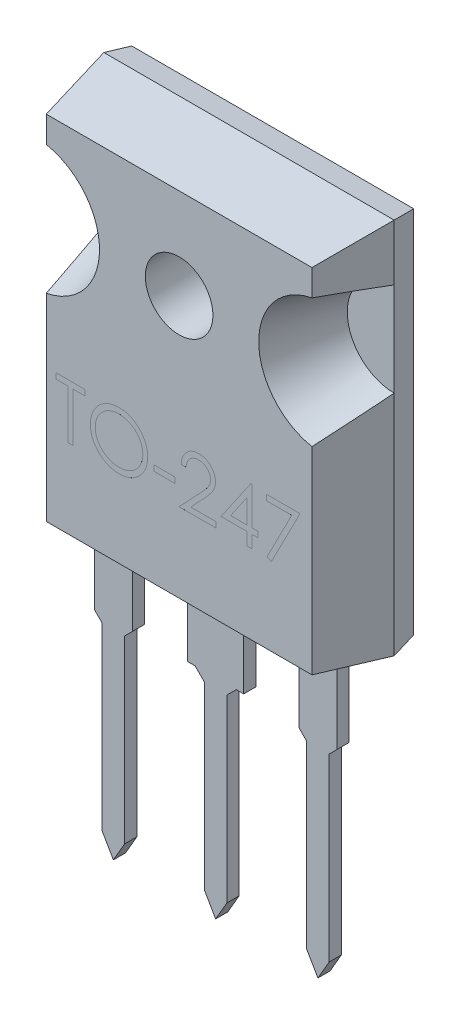
from build123d import *

# Parameters (mm, degrees)
SKETCH1_W                     = 15.5
SKETCH1_H                     = 20.15
BOSS_EXTRUDE1_DEPTH           = 1.27
BOSS_EXTRUDE1_TAPER           = 10
BOSS_EXTRUDE1_OTHER_WAY_DEPTH = 3.73
BOSS_EXTRUDE1_OTHER_WAY_TAPER = 10
SKETCH2_R                     = 2.5
CUT_EXTRUDE1_DEPTH            = 3.73
CUT_EXTRUDE1_DRAFT            = -15
CUT_EXTRUDE1_PROFILE_2_DEPTH  = 3.73
CUT_EXTRUDE1_PROFILE_2_DRAFT  = -15
CUT_EXTRUDE2_DEPTH            = 14.246925249
CUT_EXTRUDE2_DEPTH_BACK       = 14.246925249
SKETCH4_R                     = 1.805
SKETCH5_W                     = 2.02
SKETCH5_H                     = 0.65
SKETCH5_W_2                   = 3
BOSS_EXTRUDE2_DEPTH           = 14.07
SKETCH6_W                     = 7.97
SKETCH6_H                     = 2.154431013
BOSS_EXTRUDE3_DEPTH           = 0.65
SKETCH7_R                     = 1.805
BOSS_EXTRUDE4_DEPTH           = 0.0001
BOSS_EXTRUDE5_DEPTH           = 0.65
CUT_EXTRUDE3_DEPTH            = 1
CHAMFER1_SIZE                 = 0.5
SKETCH10_W                    = 1.119391026
SKETCH10_H                    = 0.298504273
CUT_EXTRUDE4_DEPTH            = 0.0001


with BuildPart() as part:
    # Sketch1 → Boss-Extrude1 (new body)
    with BuildSketch(Plane.XY):
        Rectangle(SKETCH1_W, SKETCH1_H)
    extrude(amount=-BOSS_EXTRUDE1_DEPTH, taper=BOSS_EXTRUDE1_TAPER)

    # Sketch1 → Boss-Extrude1 other way (add)
    with BuildSketch(Plane.XY):
        Rectangle(SKETCH1_W, SKETCH1_H)
    extrude(amount=BOSS_EXTRUDE1_OTHER_WAY_DEPTH, taper=BOSS_EXTRUDE1_OTHER_WAY_TAPER)


with BuildPart() as cut_extrude1_tool:
    # Sketch2 → Cut-Extrude1 (with draft: the straight prism first)
    with BuildSketch(Plane.XY):
        with Locations((-7.75, 4.575)):
            Circle(SKETCH2_R)
    extrude(amount=CUT_EXTRUDE1_DEPTH)
    # Cut-Extrude1: the draft: its side faces are tilted about the plane it starts from
    cut_extrude1_sides = [cut_extrude1_tool.faces().sort_by_distance(p)[0] for p in [
        (-10.25, 4.575, 1.865),
    ]]
    draft(cut_extrude1_sides, Plane.XY, CUT_EXTRUDE1_DRAFT)


with BuildPart() as part_1:
    add(part.part)

    # Cut-Extrude1: cut by cut_extrude1_tool
    add(cut_extrude1_tool.part, mode=Mode.SUBTRACT)


with BuildPart() as cut_extrude1_profile_2_tool:
    # Sketch2 → Cut-Extrude1 profile 2 (with draft: the straight prism first)
    with BuildSketch(Plane.XY):
        with Locations((7.75, 4.575)):
            Circle(SKETCH2_R)
    extrude(amount=CUT_EXTRUDE1_PROFILE_2_DEPTH)
    # Cut-Extrude1 profile 2: the draft: its side faces are tilted about the plane it starts from
    cut_extrude1_profile_2_sides = [cut_extrude1_profile_2_tool.faces().sort_by_distance(p)[0] for p in [
        (5.25, 4.575, 1.865),
    ]]
    draft(cut_extrude1_profile_2_sides, Plane.XY, CUT_EXTRUDE1_PROFILE_2_DRAFT)


with BuildPart() as part_2:
    add(part_1.part)

    # Cut-Extrude1 profile 2: cut by cut_extrude1_profile_2_tool
    add(cut_extrude1_profile_2_tool.part, mode=Mode.SUBTRACT)

    # Sketch4 → Cut-Extrude2 (cut, two sides: drawn at the far end of the back side and taken through both)
    with BuildSketch(Plane.XY.offset(-CUT_EXTRUDE2_DEPTH_BACK)):
        with Locations(Location((0, 4.565, 0), (0, 0, 180))):
            Circle(SKETCH4_R)
    extrude(amount=CUT_EXTRUDE2_DEPTH + CUT_EXTRUDE2_DEPTH_BACK, mode=Mode.SUBTRACT)

    # Sketch5 → Boss-Extrude2 (add)
    with BuildSketch(Plane(origin=(0, 0, 0), x_dir=(1, 0, 0), z_dir=(0, 1, 0))):
        with Locations((-5.46, -1.455)):
            Rectangle(SKETCH5_W, SKETCH5_H)
        with Locations((5.46, -1.455)):
            Rectangle(SKETCH5_W, SKETCH5_H)
        with Locations((0, -1.455)):
            Rectangle(SKETCH5_W_2, SKETCH5_H)
    extrude(amount=-BOSS_EXTRUDE2_DEPTH)

    # Sketch6 → Boss-Extrude3 (add)
    with BuildSketch(Plane.XY.offset(1.78)):
        with Locations((-2.485, -12.992784494)):
            Rectangle(SKETCH6_W, SKETCH6_H)
    extrude(amount=-BOSS_EXTRUDE3_DEPTH)

    # Sketch7 → Boss-Extrude4 (add)
    with BuildSketch(Plane(origin=(0, 0, -1.27), x_dir=(-1, 0, 0), z_dir=(0, 0, -1))):
        with BuildLine():
            Line((-5.9, 9.225), (5.9, 9.225))
            ThreePointArc((5.9, 9.225), (6.607106781, 8.932106781), (6.9, 8.225))
            Line((6.9, 8.225), (6.9, -3.855))
            Line((6.9, -3.855), (-6.9, -3.855))
            Line((-6.9, -3.855), (-6.9, 8.225))
            ThreePointArc((-6.9, 8.225), (-6.607106781, 8.932106781), (-5.9, 9.225))
        make_face()
        with Locations((0, 4.565)):
            Circle(SKETCH7_R, mode=Mode.SUBTRACT)
    extrude(amount=BOSS_EXTRUDE4_DEPTH)

    # Sketch8 → Boss-Extrude5 (add)
    with BuildSketch(Plane.XY.offset(1.78)):
        Polygon((-6.06, -14.07), (-6.06, -24.185769515), (-5.46, -25.225), (-4.86, -24.185769515), (-4.86, -14.07), align=None)
        Polygon((6.06, -14.07), (6.06, -24.185769515), (5.46, -25.225), (4.86, -24.185769515), (4.86, -14.07), align=None)
        Polygon((-0.6, -14.07), (-0.6, -24.185769515), (0, -25.225), (0.6, -24.185769515), (0.6, -14.07), align=None)
    extrude(amount=-BOSS_EXTRUDE5_DEPTH)

    # Sketch9 → Cut-Extrude3 (cut)
    with BuildSketch(Plane.XY.offset(1.78)):
        Polygon((-1.5, -11.915568987), (-1.5, -14.07), (-1.5, -14.32), (-4.45, -14.32), (-4.45, -14.07), (-4.45, -11.915568987), align=None)
    extrude(amount=-CUT_EXTRUDE3_DEPTH, mode=Mode.SUBTRACT)

    # Chamfer1
    # the kernel refuses this chamfer: 0.5 mm, written as the material it adds along each edge
    with BuildSketch(Plane(origin=(-4.86, -14.07, 1.78), x_dir=(0.9996219169112968, 0.027495876610585647, 0), z_dir=(0, 0, -1))) as chamfer1_piece_1_section:
        Polygon((CHAMFER1_SIZE * 0.999621916911, CHAMFER1_SIZE * 0.0274958766106), (-CHAMFER1_SIZE * 0.0274958766106, CHAMFER1_SIZE * 0.999621916911), (0, 0), align=None)
    chamfer1_piece_1 = extrude(amount=0.65, mode=Mode.PRIVATE)
    chamfer1_piece_1 = split(chamfer1_piece_1, bisect_by=Plane(origin=(-4.45, -14.241727984, 1.455), z_dir=(-1, 0, 0)), keep=Keep.TOP, mode=Mode.PRIVATE)
    add(chamfer1_piece_1)
    with BuildSketch(Plane(origin=(-6.06, -14.07, 1.78), x_dir=(-0.9996219169112968, 0.027495876610585647, 0), z_dir=(0, 0, -1))) as chamfer1_piece_2_section:
        Polygon((CHAMFER1_SIZE * 0.999621916911, -CHAMFER1_SIZE * 0.0274958766106), (-CHAMFER1_SIZE * 0.0274958766106, -CHAMFER1_SIZE * 0.999621916911), (0, 0), align=None)
    chamfer1_piece_2 = extrude(amount=0.65, mode=Mode.PRIVATE)
    chamfer1_piece_2 = split(chamfer1_piece_2, bisect_by=Plane(origin=(-6.47, -14.241727984, 1.455), z_dir=(1, 0, 0)), keep=Keep.TOP, mode=Mode.PRIVATE)
    add(chamfer1_piece_2)
    with BuildSketch(Plane(origin=(0.6, -14.07, 1.78), x_dir=(0.9996219169112968, 0.027495876610585647, 0), z_dir=(0, 0, -1))) as chamfer1_piece_3:
        Polygon((CHAMFER1_SIZE * 0.999621916911, CHAMFER1_SIZE * 0.0274958766106), (-CHAMFER1_SIZE * 0.0274958766106, CHAMFER1_SIZE * 0.999621916911), (0, 0), align=None)
    extrude(amount=0.65)
    with BuildSketch(Plane(origin=(-0.6, -14.07, 1.78), x_dir=(-0.9996219169112968, 0.027495876610585616, 0), z_dir=(0, 0, -1))) as chamfer1_piece_4:
        Polygon((CHAMFER1_SIZE * 0.999621916911, -CHAMFER1_SIZE * 0.0274958766106), (-CHAMFER1_SIZE * 0.0274958766106, -CHAMFER1_SIZE * 0.999621916911), (0, 0), align=None)
    extrude(amount=0.65)
    with BuildSketch(Plane(origin=(6.06, -14.07, 1.78), x_dir=(0.999621916911297, 0.0274958766105822, 0), z_dir=(0, 0, -1))) as chamfer1_piece_5_section:
        Polygon((CHAMFER1_SIZE * 0.999621916911, CHAMFER1_SIZE * 0.0274958766106), (-CHAMFER1_SIZE * 0.0274958766106, CHAMFER1_SIZE * 0.999621916911), (0, 0), align=None)
    chamfer1_piece_5 = extrude(amount=0.65, mode=Mode.PRIVATE)
    chamfer1_piece_5 = split(chamfer1_piece_5, bisect_by=Plane(origin=(6.47, -14.241727984, 1.455), z_dir=(-1, 0, 0)), keep=Keep.TOP, mode=Mode.PRIVATE)
    add(chamfer1_piece_5)
    with BuildSketch(Plane(origin=(4.86, -14.07, 1.78), x_dir=(-0.999621916911297, 0.0274958766105822, 0), z_dir=(0, 0, -1))) as chamfer1_piece_6_section:
        Polygon((CHAMFER1_SIZE * 0.999621916911, -CHAMFER1_SIZE * 0.0274958766106), (-CHAMFER1_SIZE * 0.0274958766106, -CHAMFER1_SIZE * 0.999621916911), (0, 0), align=None)
    chamfer1_piece_6 = extrude(amount=0.65, mode=Mode.PRIVATE)
    chamfer1_piece_6 = split(chamfer1_piece_6, bisect_by=Plane(origin=(4.45, -14.241727984, 1.455), z_dir=(1, 0, 0)), keep=Keep.TOP, mode=Mode.PRIVATE)
    add(chamfer1_piece_6)

    # Sketch10 → Cut-Extrude4 (cut)
    # profile 1 of 6: a face of its own
    with BuildSketch(Plane.XY.offset(3.73)):
        Polygon((-6.567094017, -2.579909172), (-6.567094017, -2.281404898), (-5.037259615, -2.281404898), (-5.037259615, -2.579909172), (-5.671581197, -2.579909172), (-5.671581197, -5.191821565), (-5.932772436, -5.191821565), (-5.932772436, -2.579909172), align=None)
    # profile 2 of 6: a face of its own
    with BuildSketch(Plane.XY.offset(3.73)):
        with BuildLine():
            add(Edge.make_bspline(
                [(-3.227577457, -2.20677883), (-3.173686431, -2.208143798), (-3.067840009, -2.210824709), (-2.912278324, -2.231346558), (-2.763767997, -2.266849808), (-2.621099257, -2.314134086), (-2.485978609, -2.377210619), (-2.357389006, -2.453451186), (-2.235636404, -2.543654527), (-2.122361838, -2.647123355), (-2.018703648, -2.759701143), (-1.927378194, -2.879841405), (-1.850840643, -3.006817731), (-1.787987462, -3.140248553), (-1.738677844, -3.279832109), (-1.704651711, -3.426312551), (-1.682916594, -3.578740793), (-1.68037557, -3.682706584), (-1.679086538, -3.735447199)],
                knots=[0, 0, 0, 0, 1.065120563, 2.091984664, 3.0946048, 4.079830382, 5.057816894, 6.036188127, 7.030412546, 8.04752943, 9.064399622, 10.05169764, 11.02544977, 11.989514704, 12.962713494, 13.945757189, 14.957906945, 16, 16, 16, 16], degree=3))
            add(Edge.make_bspline(
                [(-1.679086538, -3.735447199), (-1.680375381, -3.787799314), (-1.682915839, -3.890991397), (-1.704676424, -4.042452344), (-1.73880397, -4.188048596), (-1.787529556, -4.327537094), (-1.850083123, -4.461064985), (-1.92713031, -4.588280922), (-2.017886424, -4.709226612), (-2.121170335, -4.822577084), (-2.233762749, -4.926518433), (-2.354528632, -5.017089665), (-2.480752006, -5.095025737), (-2.614057162, -5.157211923), (-2.75267618, -5.206915122), (-2.897849696, -5.240802874), (-3.048897455, -5.262661802), (-3.151902093, -5.265171842), (-3.204256811, -5.266447633)],
                knots=[0, 0, 0, 0, 1.043624062, 2.057103931, 3.04512605, 4.022047818, 4.998200453, 5.980619268, 6.982898556, 8.009068085, 9.034988726, 10.034168286, 11.015286542, 11.987931943, 12.962482838, 13.94673481, 14.956375938, 16, 16, 16, 16], degree=3))
            add(Edge.make_bspline(
                [(-3.204256811, -5.266447633), (-3.256997152, -5.265159244), (-3.360962405, -5.262619487), (-3.513582189, -5.240848402), (-3.660165527, -5.206803758), (-3.800293235, -5.158150376), (-3.934043453, -5.095271048), (-4.061677766, -5.018598716), (-4.182683866, -4.927621468), (-4.296058521, -4.824371049), (-4.39979342, -4.711969466), (-4.49023202, -4.591532887), (-4.566921593, -4.465424153), (-4.629589793, -4.333293295), (-4.679203632, -4.195779065), (-4.713051627, -4.051964171), (-4.734951225, -3.902668522), (-4.737474844, -3.801017731), (-4.738755342, -3.749439587)],
                knots=[0, 0, 0, 0, 1.053102029, 2.075944431, 3.073151272, 4.055350789, 5.033113405, 6.020478099, 7.024410459, 8.052272461, 9.079885166, 10.07527673, 11.055994387, 12.023226415, 12.992069828, 13.970394897, 14.97016774, 16, 16, 16, 16], degree=3))
            add(Edge.make_bspline(
                [(-4.738755342, -3.749439587), (-4.738310767, -3.71482004), (-4.737427226, -3.646017688), (-4.726790324, -3.543848259), (-4.711355386, -3.44332192), (-4.689234629, -3.344724531), (-4.660303701, -3.24829745), (-4.626166985, -3.153375655), (-4.584473316, -3.060921094), (-4.537340658, -2.970495786), (-4.484735453, -2.883509331), (-4.426630439, -2.801286249), (-4.365066505, -2.723136575), (-4.297575278, -2.651085465), (-4.226381127, -2.583036883), (-4.150329131, -2.520036576), (-4.069883348, -2.461516453), (-3.984697631, -2.408779419), (-3.896871006, -2.361082567), (-3.80633478, -2.320152254), (-3.714318572, -2.285022643), (-3.620391403, -2.256549766), (-3.524802699, -2.234071341), (-3.427343834, -2.21876475), (-3.328092451, -2.208100719), (-3.26122661, -2.207221355), (-3.227577457, -2.20677883)],
                knots=[0, 0, 0, 0, 1.037015668, 2.060948919, 3.074880161, 4.083647147, 5.086022904, 6.090072063, 7.104153813, 8.122640571, 9.144368836, 10.147691507, 11.138137339, 12.123020368, 13.103399296, 14.087645067, 15.080126199, 16.082011238, 17.087798457, 18.072939717, 19.057185487, 20.037253025, 21.01195951, 21.997135196, 22.992090687, 24, 24, 24, 24], degree=3))
        make_face()
        with BuildLine():
            add(Edge.make_bspline(
                [(-3.214751102, -2.505283103), (-3.242370651, -2.505619789), (-3.297345705, -2.506289941), (-3.379073977, -2.515117414), (-3.459727389, -2.527698637), (-3.539322597, -2.5456447), (-3.617526565, -2.57009557), (-3.695068248, -2.598235896), (-3.77124055, -2.632513196), (-3.845792002, -2.671240618), (-3.918066025, -2.714106), (-3.986263492, -2.761480737), (-4.050560952, -2.812253833), (-4.110800978, -2.866543778), (-4.166806685, -2.924627048), (-4.219680392, -2.985623092), (-4.267302777, -3.051275349), (-4.310947033, -3.119803527), (-4.350003029, -3.191118365), (-4.38473291, -3.264469066), (-4.41314191, -3.340453964), (-4.436310803, -3.418248701), (-4.455519396, -3.497730068), (-4.4676882, -3.579501009), (-4.476612668, -3.663150635), (-4.477244516, -3.719680784), (-4.477564103, -3.748273555)],
                knots=[0, 0, 0, 0, 1.008559885, 2.007477868, 2.99961109, 3.989939068, 4.984837346, 5.991145699, 7.001802488, 8.033829008, 9.059044045, 10.069351652, 11.065060232, 12.050310815, 13.029377138, 14.011219647, 14.996725999, 15.989392538, 16.977580475, 17.965360261, 18.951710183, 19.937753436, 20.929683414, 21.935841486, 22.955955122, 24, 24, 24, 24], degree=3))
            add(Edge.make_bspline(
                [(-4.477564103, -3.748273555), (-4.476503994, -3.790318449), (-4.474418433, -3.873033763), (-4.456159668, -3.994246916), (-4.428035085, -4.110736997), (-4.386576311, -4.221866609), (-4.334728806, -4.328590992), (-4.270677279, -4.429963386), (-4.194791003, -4.526011189), (-4.108589845, -4.616063862), (-4.014356618, -4.698258855), (-3.914294223, -4.770406761), (-3.809474646, -4.83145088), (-3.699624542, -4.881181645), (-3.585330368, -4.920588469), (-3.465855643, -4.947595997), (-3.341996243, -4.965370706), (-3.257568668, -4.96707767), (-3.214751102, -4.96794336)],
                knots=[0, 0, 0, 0, 1.032063989, 2.030389145, 3.003944642, 3.970395727, 4.937377036, 5.913328081, 6.909231446, 7.93887556, 8.970685674, 9.976071282, 10.964166581, 11.944589148, 12.933237628, 13.927779006, 14.949070134, 16, 16, 16, 16], degree=3))
            add(Edge.make_bspline(
                [(-3.214751102, -4.96794336), (-3.185971653, -4.967547955), (-3.128893363, -4.966763749), (-3.043996074, -4.958865147), (-2.96062826, -4.946199123), (-2.878906854, -4.927962738), (-2.798924603, -4.905139079), (-2.720347674, -4.8780242), (-2.644013024, -4.844195842), (-2.568957671, -4.80681948), (-2.497115082, -4.764210849), (-2.42853275, -4.718444007), (-2.364939331, -4.667745696), (-2.304744371, -4.614262372), (-2.248508727, -4.556915648), (-2.196612685, -4.495780083), (-2.149230991, -4.430469786), (-2.105603308, -4.362045553), (-2.066684166, -4.290535574), (-2.032774403, -4.216918931), (-2.004006086, -4.141376897), (-1.980782204, -4.063800512), (-1.9625834, -3.984337116), (-1.950043729, -3.902880309), (-1.9412722, -3.819593047), (-1.940611055, -3.763260805), (-1.940277778, -3.734864183)],
                knots=[0, 0, 0, 0, 1.047197238, 2.076906641, 3.100256066, 4.114471768, 5.12198147, 6.126382909, 7.136867548, 8.15857795, 9.17633901, 10.174870724, 11.156907918, 12.133735059, 13.104061851, 14.077631395, 15.04955518, 16.038496417, 17.029181396, 18.010275684, 18.986308667, 19.968651475, 20.955262928, 21.950658345, 22.966943676, 24, 24, 24, 24], degree=3))
            add(Edge.make_bspline(
                [(-1.940277778, -3.734864183), (-1.940611322, -3.706661826), (-1.941272969, -3.650717257), (-1.950039539, -3.56801085), (-1.962596648, -3.487140173), (-1.980693377, -3.408422713), (-2.004018415, -3.331838404), (-2.032779427, -3.257459174), (-2.066694346, -3.185007931), (-2.105617614, -3.114663745), (-2.149370176, -3.047163085), (-2.197179377, -2.982632983), (-2.249870682, -2.922285293), (-2.305938632, -2.864630193), (-2.366783708, -2.810897341), (-2.43213029, -2.761068912), (-2.501185063, -2.713942385), (-2.574300746, -2.671429046), (-2.649758665, -2.632168163), (-2.727187355, -2.598531228), (-2.805709648, -2.569949174), (-2.885125865, -2.545570721), (-2.966104449, -2.527768925), (-3.048098228, -2.515106076), (-3.130993762, -2.506293014), (-3.186743392, -2.505620809), (-3.214751102, -2.505283103)],
                knots=[0, 0, 0, 0, 1.02996197, 2.043119294, 3.035359645, 4.018872909, 4.991431989, 5.957985074, 6.929999688, 7.912076566, 8.892894881, 9.867085534, 10.843653904, 11.817741046, 12.803660682, 13.806313499, 14.818574707, 15.856120519, 16.894564902, 17.924820532, 18.937903209, 19.946497019, 20.957711757, 21.963978472, 22.977135795, 24, 24, 24, 24], degree=3))
        make_face(mode=Mode.SUBTRACT)
    # profile 3 of 6: a face of its own
    with BuildSketch(Plane.XY.offset(3.73)):
        with Locations((-0.783573718, -4.07243054)):
            Rectangle(SKETCH10_W, SKETCH10_H)
    # profile 4 of 6: a face of its own
    with BuildSketch(Plane.XY.offset(3.73)):
        with BuildLine():
            Line((0.373130342, -3.176917719), (0.111939103, -3.176917719))
            add(Edge.make_bspline(
                [(0.111939103, -3.176917719), (0.113641408, -3.142266391), (0.11698469, -3.074212106), (0.132641309, -2.974988596), (0.155043931, -2.8801466), (0.186718789, -2.79044763), (0.226056212, -2.705098574), (0.273229931, -2.624438442), (0.329104817, -2.548774935), (0.392474346, -2.478809481), (0.46130041, -2.41462434), (0.535562552, -2.359197331), (0.613599161, -2.312366506), (0.695173482, -2.273216211), (0.781205868, -2.243829447), (0.870915601, -2.222024905), (0.964696824, -2.208906122), (1.028592961, -2.207495995), (1.06108941, -2.20677883)],
                knots=[0, 0, 0, 0, 1.10065271, 2.161652631, 3.183658789, 4.190468796, 5.17591951, 6.163126047, 7.15150782, 8.156236427, 9.156009102, 10.134482811, 11.092018607, 12.041330605, 13.001268258, 13.972401359, 14.968799086, 16, 16, 16, 16], degree=3))
            add(Edge.make_bspline(
                [(1.06108941, -2.20677883), (1.093002606, -2.207525939), (1.155710896, -2.208993982), (1.247232702, -2.2216011), (1.334360012, -2.24134669), (1.416922518, -2.269050046), (1.494261489, -2.306290429), (1.566957914, -2.351025645), (1.635877255, -2.402764397), (1.697916348, -2.463678431), (1.754884078, -2.528707438), (1.804030418, -2.598131606), (1.846117673, -2.669835363), (1.881198738, -2.74436548), (1.907023397, -2.822423711), (1.926629799, -2.902873617), (1.937712178, -2.986547939), (1.939413046, -3.043181783), (1.940277778, -3.07197481)],
                knots=[0, 0, 0, 0, 1.111607364, 2.184268762, 3.212621178, 4.221274766, 5.211760367, 6.196651075, 7.1921475, 8.207485113, 9.220403448, 10.201281604, 11.166441695, 12.114753415, 13.065576456, 14.026450734, 14.996634279, 16, 16, 16, 16], degree=3))
            add(Edge.make_bspline(
                [(1.940277778, -3.07197481), (1.938869749, -3.112510956), (1.936078401, -3.192871896), (1.912201029, -3.310964017), (1.87490902, -3.425379497), (1.830007646, -3.517462836), (1.784711215, -3.591664736), (1.743892615, -3.652757462), (1.696107888, -3.718537426), (1.640661542, -3.788784355), (1.57870054, -3.864048483), (1.509663658, -3.944284342), (1.433058596, -4.028662951), (1.379291974, -4.086293859), (1.351431457, -4.116156751)],
                knots=[0, 0, 0, 0, 1.184426356, 2.348067706, 3.509069118, 4.696110526, 5.333549288, 6.050745305, 6.844228056, 7.710549037, 8.667450064, 9.695053472, 10.805634456, 12, 12, 12, 12], degree=3))
            Line((1.351431457, -4.116156751), (0.623244274, -4.893317292))
            Line((0.623244274, -4.893317292), (1.977590812, -4.893317292))
            Line((1.977590812, -4.893317292), (1.977590812, -5.191821565))
            Line((1.977590812, -5.191821565), (0, -5.191821565))
            Line((0, -5.191821565), (1.128719284, -3.98731018))
            add(Edge.make_bspline(
                [(1.128719284, -3.98731018), (1.156200176, -3.958623195), (1.208985344, -3.903521369), (1.283643832, -3.823074991), (1.350698991, -3.748443974), (1.410584883, -3.679769326), (1.462002387, -3.616046528), (1.507631261, -3.559339385), (1.544190743, -3.507156071), (1.583868367, -3.446668787), (1.622297493, -3.372817116), (1.655320208, -3.282566185), (1.675456008, -3.189659654), (1.677871517, -3.126876115), (1.679086538, -3.095295457)],
                knots=[0, 0, 0, 0, 1.329631726, 2.553950428, 3.673215718, 4.687767853, 5.603093632, 6.413772471, 7.123043292, 7.734684054, 8.834405432, 9.900288307, 10.943827018, 12, 12, 12, 12], degree=3))
            add(Edge.make_bspline(
                [(1.679086538, -3.095295457), (1.678557888, -3.075436937), (1.677516021, -3.036299607), (1.668321019, -2.978918032), (1.654425437, -2.92356622), (1.634513815, -2.87007391), (1.608231305, -2.818978924), (1.576238858, -2.770219067), (1.539326406, -2.723079493), (1.496625381, -2.678879995), (1.449716516, -2.638399254), (1.400161059, -2.602539524), (1.347731895, -2.572571287), (1.292650079, -2.548004462), (1.235069174, -2.528733029), (1.174877812, -2.515379556), (1.112242305, -2.50699549), (1.069472904, -2.505861116), (1.047680038, -2.505283103)],
                knots=[0, 0, 0, 0, 0.991446411, 1.95395049, 2.89581595, 3.838931463, 4.798493298, 5.75982156, 6.748411868, 7.785213223, 8.824556874, 9.840280684, 10.836137867, 11.835679398, 12.848801643, 13.863922112, 14.911575587, 16, 16, 16, 16], degree=3))
            add(Edge.make_bspline(
                [(1.047680038, -2.505283103), (1.024919887, -2.505877687), (0.980222709, -2.50704535), (0.914597775, -2.515213363), (0.851994066, -2.529304637), (0.792254103, -2.548577145), (0.735276804, -2.573073331), (0.681339263, -2.603584264), (0.630562563, -2.639992323), (0.582851251, -2.68127081), (0.538892335, -2.727228452), (0.500269546, -2.77846007), (0.466522006, -2.834030248), (0.437077542, -2.893789044), (0.413165817, -2.958278705), (0.394894096, -3.027270303), (0.380436105, -3.100464273), (0.375606043, -3.151009966), (0.373130342, -3.176917719)],
                knots=[0, 0, 0, 0, 1.031018746, 2.02475058, 2.990194455, 3.934040569, 4.864654155, 5.795059489, 6.735614925, 7.690564532, 8.649604399, 9.611025574, 10.590972636, 11.591080095, 12.624614302, 13.701020113, 14.821632451, 16, 16, 16, 16], degree=3))
        make_face()
    # profile 5 of 6: a face of its own
    with BuildSketch(Plane.XY.offset(3.73)):
        Polygon((3.827501085, -2.20677883), (3.880555556, -2.20677883), (3.880555556, -4.221682676), (4.216372863, -4.221682676), (4.216372863, -4.52018695), (3.880555556, -4.52018695), (3.880555556, -5.191821565), (3.619364316, -5.191821565), (3.619364316, -4.52018695), (2.238782051, -4.52018695), align=None)
        Polygon((3.619364316, -4.221682676), (3.619364316, -2.957703643), (2.751836271, -4.221682676), align=None, mode=Mode.SUBTRACT)
    # profile 6 of 6: a face of its own
    with BuildSketch(Plane.XY.offset(3.73)):
        Polygon((4.664129274, -2.281404898), (6.455154915, -2.281404898), (4.925320513, -5.266447633), (4.699693259, -5.142265191), (6.013228666, -2.579909172), (4.664129274, -2.579909172), align=None)
    extrude(amount=-CUT_EXTRUDE4_DEPTH, mode=Mode.SUBTRACT)


solid = part_2.part
